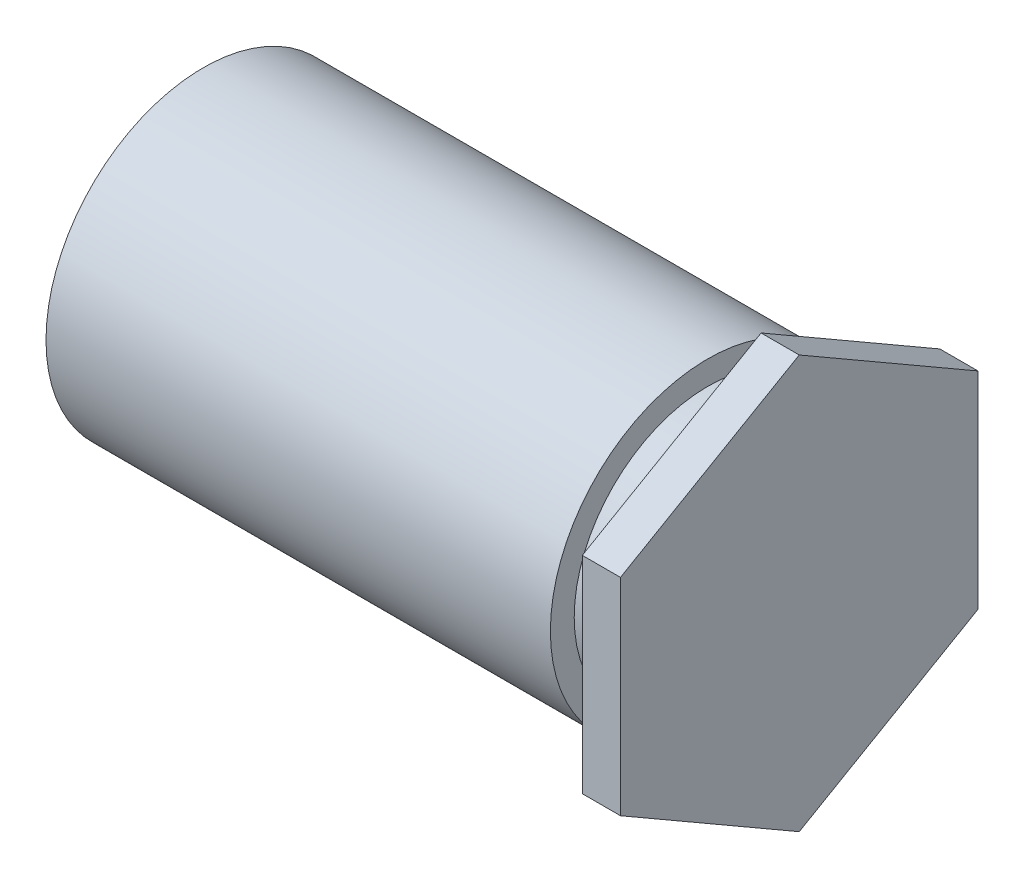
from build123d import *

# Parameters (mm, degrees)
SKETCH2_R      = 2.0955
EXTRUDE1_DEPTH = 7.9375
EXTRUDE2_DEPTH = 0.508
EXTRUDE3_START = 0.7112
SKETCH4_R      = 2.0955
SKETCH4_R_2    = 1.778
EXTRUDE3_DEPTH = 0.7112
SKETCH5_R      = 1.4224
EXTRUDE4_DEPTH = 3.96875
SWEEP1_PITCH   = 0.635
SKETCH8_R      = 1.4732
EXTRUDE6_DEPTH = 9.73125


with BuildPart() as part:
    # Sketch2 → Extrude1 (new body)
    with BuildSketch(Plane(origin=(-3.96875, 0, 0), x_dir=(0, 0, -1), z_dir=(1, 0, 0))):
        Circle(SKETCH2_R)
    extrude(amount=EXTRUDE1_DEPTH)

    # Sketch3 → Extrude2 (add)
    with BuildSketch(Plane(origin=(3.96875, 0, 0), x_dir=(0, 0, -1), z_dir=(1, 0, 0))):
        Polygon((0, 2.749630657), (-2.38125, 1.374815329), (-2.38125, -1.374815329), (0, -2.749630657), (2.38125, -1.374815329), (2.38125, 1.374815329), align=None)
    extrude(amount=-EXTRUDE2_DEPTH)

    # Sketch4 → Extrude3 (cut)
    with BuildSketch(Plane.ZY.offset(-3.46075).offset(EXTRUDE3_START)):
        Circle(SKETCH4_R)
        Circle(SKETCH4_R_2, mode=Mode.SUBTRACT)
    extrude(amount=-EXTRUDE3_DEPTH, mode=Mode.SUBTRACT)

    # Sketch5 → Extrude4 (cut)
    with BuildSketch(Plane.ZY.offset(3.96875)):
        Circle(SKETCH5_R)
    extrude(amount=-EXTRUDE4_DEPTH, mode=Mode.SUBTRACT)

    # Sweep1: the profile of Sketch7 profile screwed along a right-hand helix of 6.25 turns, 6 arcs to a turn; built about Z, then put on its axis
    sweep1_z = Axis((0, 0, 0), (0, 0, 1))
    sweep1_corners = [(1.4227, 0, -0.555798205), (1.4227, 0, 0.000173205), (1.009955401, 0, -0.238125), (1.009955401, 0, -0.3175)]
    with BuildLine(mode=Mode.PRIVATE) as sweep1_profile:
        Line(sweep1_corners[0], sweep1_corners[1])
        Line(sweep1_corners[1], sweep1_corners[2])
        Line(sweep1_corners[2], sweep1_corners[3])
        Line(sweep1_corners[3], sweep1_corners[0])
    sweep1_cap = Face(sweep1_profile.wire())
    sweep1_turn_angles = [0, 30, 60, 90, 120, 150, 180, 210, 240, 270, 300, 330, 360]
    sweep1_turn_weights = [1, 0.8660254037844387, 1, 0.8660254037844387, 1, 0.8660254037844387, 1, 0.8660254037844387, 1, 0.8660254037844387, 1, 0.8660254037844387, 1]
    sweep1_turn_rails = [Edge.make_bspline([Vector(p[0], p[1], 0).rotate(sweep1_z, sweep1_turn_angles[k]) / sweep1_turn_weights[k] + Vector(0, 0, p[2] + SWEEP1_PITCH * sweep1_turn_angles[k] / 360) for k in range(13)], [0, 0, 0, 1, 1, 2, 2, 3, 3, 4, 4, 5, 5, 6, 6, 6], 2, sweep1_turn_weights) for p in sweep1_corners]
    sweep1_turn_sides = [Face.make_surface_from_curves(sweep1_turn_rails[p[0]], sweep1_turn_rails[p[1]]) for p in [(0, 1), (1, 2), (2, 3), (3, 0)]]
    sweep1_last_angles = [2160, 2190, 2220, 2235, 2250]
    sweep1_last_weights = [1, 0.8660254037844387, 1, 0.9659258262890652, 1]
    sweep1_last_rails = [Edge.make_bspline([Vector(p[0], p[1], 0).rotate(sweep1_z, sweep1_last_angles[k]) / sweep1_last_weights[k] + Vector(0, 0, p[2] + SWEEP1_PITCH * sweep1_last_angles[k] / 360) for k in range(5)], [0, 0, 0, 1, 1, 2, 2, 2], 2, sweep1_last_weights) for p in sweep1_corners]
    sweep1_last_sides = [Face.make_surface_from_curves(sweep1_last_rails[p[0]], sweep1_last_rails[p[1]]) for p in [(0, 1), (1, 2), (2, 3), (3, 0)]]
    sweep1 = Plane(origin=(-3.96875, 0, 0), x_dir=(0, 1, 0), z_dir=(1, 0, 0)) * Solid(Shell([*[p.moved(Location((0, 0, SWEEP1_PITCH * i))) for i in range(6) for p in sweep1_turn_sides], *sweep1_last_sides, sweep1_cap, sweep1_cap.rotate(sweep1_z, 2250).moved(Location((0, 0, SWEEP1_PITCH * 2250 / 360)))]))
    add(sweep1)

    # Sketch8 → Extrude6 (cut)
    with BuildSketch(Plane.ZY.offset(3.96875)):
        Circle(SKETCH8_R)
    extrude(amount=EXTRUDE6_DEPTH, mode=Mode.SUBTRACT)

    # Extrude6 cone 1 section (through the dimple's axis) → Extrude6 other way (revolve, cut)
    with BuildSketch(Plane(origin=(-3.96875, 0, 0), x_dir=(0, 0, 1), z_dir=(0, 1, 0))):
        Polygon((0, 0), (1.4732, 0), (0, 1.4732), align=None)
    revolve(axis=Axis((-3.96875, 0, 0), (1, 0, 0)), mode=Mode.SUBTRACT)


solid = part.part
